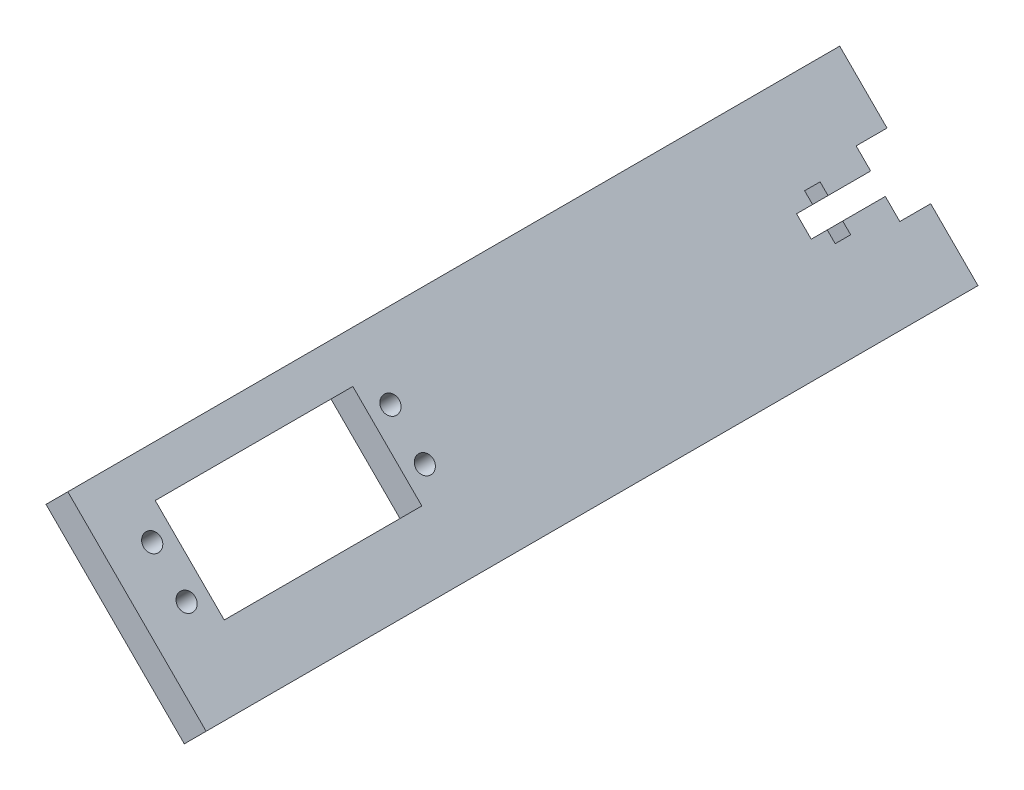
from build123d import *

# Parameters (mm, degrees)
BOSS_EXTRUDE1_DEPTH = 152.4
CUT_EXTRUDE1_DEPTH  = 180.602562857
BOSS_EXTRUDE2_DEPTH = 6.35
SKETCH5_W           = 40.64
SKETCH5_H           = 20.066
CUT_EXTRUDE2_DEPTH  = 180.602562857
SKETCH6_R           = 1.778
CUT_EXTRUDE3_DEPTH  = 180.602562857


with BuildPart() as part:
    # Sketch2 → Boss-Extrude1 (new body)
    with BuildSketch(Plane.XY):
        Polygon((-62.120200579, -135.063890937), (-66.610328639, -139.554018997), (-38.166088515, -167.998259122), (-33.675960454, -163.508131061), align=None)
    extrude(amount=BOSS_EXTRUDE1_DEPTH)

    # Sketch3 → Cut-Extrude1 (cut, through all)
    with BuildSketch(Plane(origin=(-103.082173818, -103.082173818, 0), x_dir=(0, 0, 1), z_dir=(-0.7071067811865479, -0.7071067811865472, 0))):
        Polygon((0, -69.558493175), (0, -73.825693175), (8.763, -73.825693175), (8.763, -76.137093175), (11.938, -76.137093175), (11.938, -73.825693175), (15.24, -73.825693175), (15.24, -69.558493175), (11.938, -69.558493175), (11.938, -67.247093175), (8.763, -67.247093175), (8.763, -69.558493175), align=None)
    extrude(amount=-CUT_EXTRUDE1_DEPTH, mode=Mode.SUBTRACT)

    # Sketch4 → Boss-Extrude2 (add)
    with BuildSketch(Plane(origin=(0, 0, 0), x_dir=(-1, 0, 0), z_dir=(0, 0, -1))):
        Polygon((66.610328639, -139.554018997), (56.878336637, -149.286010999), (52.388208577, -144.795882939), (62.120200579, -135.063890937), align=None)
        Polygon((33.675960454, -163.508131061), (43.407952456, -153.77613906), (47.898080516, -158.26626712), (38.166088515, -167.998259122), align=None)
    extrude(amount=BOSS_EXTRUDE2_DEPTH)

    # Sketch5 → Cut-Extrude2 (cut, through all)
    with BuildSketch(Plane(origin=(-98.592045758, -98.592045758, 0), x_dir=(0, 0, -1), z_dir=(0.7071067811865476, 0.7071067811865476, 0))):
        with Locations((-119.38, -69.072208253)):
            Rectangle(SKETCH5_W, SKETCH5_H)
    extrude(amount=-CUT_EXTRUDE2_DEPTH, mode=Mode.SUBTRACT)

    # Sketch6 → Cut-Extrude3 (cut, through all)
    with BuildSketch(Plane(origin=(-98.592045758, -98.592045758, 0), x_dir=(0, 0, -1), z_dir=(0.7071067811865476, 0.7071067811865476, 0))):
        with Locations((-143.88, -64.072208253)):
            Circle(SKETCH6_R)
        with Locations((-143.88, -74.072208253)):
            Circle(SKETCH6_R)
        with Locations((-94.88, -64.072208253)):
            Circle(SKETCH6_R)
        with Locations((-94.88, -74.072208253)):
            Circle(SKETCH6_R)
    extrude(amount=-CUT_EXTRUDE3_DEPTH, mode=Mode.SUBTRACT)


solid = part.part
